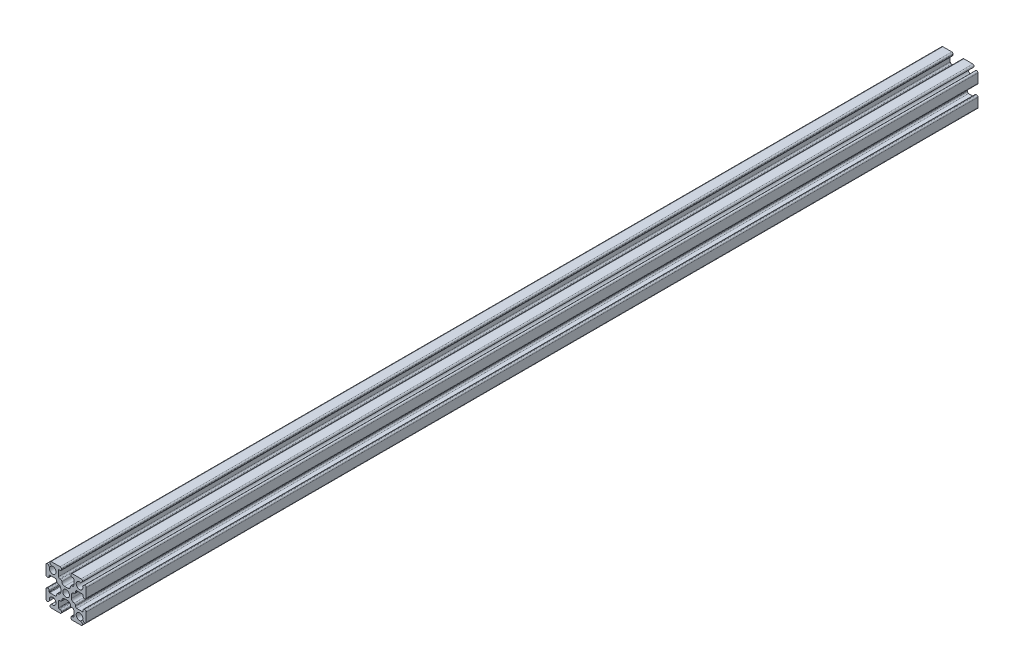
from build123d import *

# Parameters (mm, degrees)
SKETCH1_R           = 1.25
BOSS_EXTRUDE1_DEPTH = 332.35


with BuildPart() as part:
    # Sketch1 → Boss-Extrude1 (new body)
    with BuildSketch(Plane.XY):
        with BuildLine():
            Line((6.646446609, 5.939339828), (6.163645978, 5.456539197))
            ThreePointArc((6.163645978, 5.456539197), (4.116116524, 4.116116524), (5.456539197, 6.163645978))
            Line((5.456539197, 6.163645978), (5.939339828, 6.646446609))
            ThreePointArc((5.939339828, 6.646446609), (6.047726204, 7.191341716), (5.585786438, 7.5))
            Line((5.585786438, 7.5), (2.25, 7.5))
            ThreePointArc((2.25, 7.5), (1.896446609, 7.353553391), (1.75, 7))
            Line((1.75, 7), (1.75, 6.8))
            ThreePointArc((1.75, 6.8), (1.896446609, 6.446446609), (2.25, 6.3))
            Line((2.25, 6.3), (2.65, 6.3))
            ThreePointArc((2.65, 6.3), (2.791421356, 6.241421356), (2.85, 6.1))
            Line((2.85, 6.1), (2.85, 4))
            ThreePointArc((2.85, 4), (2.703553391, 3.646446609), (2.35, 3.5))
            Line((2.35, 3.5), (2.1, 3.5))
            ThreePointArc((2.1, 3.5), (1.746446609, 3.353553391), (1.6, 3))
            ThreePointArc((1.6, 3), (1.307106781, 2.292893219), (0.6, 2))
            Line((0.6, 2), (-0.6, 2))
            ThreePointArc((-0.6, 2), (-1.307106781, 2.292893219), (-1.6, 3))
            ThreePointArc((-1.6, 3), (-1.746446609, 3.353553391), (-2.1, 3.5))
            Line((-2.1, 3.5), (-2.35, 3.5))
            ThreePointArc((-2.35, 3.5), (-2.703553391, 3.646446609), (-2.85, 4))
            Line((-2.85, 4), (-2.85, 6.1))
            ThreePointArc((-2.85, 6.1), (-2.791421356, 6.241421356), (-2.65, 6.3))
            Line((-2.65, 6.3), (-2.25, 6.3))
            ThreePointArc((-2.25, 6.3), (-1.896446609, 6.446446609), (-1.75, 6.8))
            Line((-1.75, 6.8), (-1.75, 7))
            ThreePointArc((-1.75, 7), (-1.896446609, 7.353553391), (-2.25, 7.5))
            Line((-2.25, 7.5), (-5.585786438, 7.5))
            ThreePointArc((-5.585786438, 7.5), (-6.047726204, 7.191341716), (-5.939339828, 6.646446609))
            Line((-5.939339828, 6.646446609), (-5.456539197, 6.163645978))
            ThreePointArc((-5.456539197, 6.163645978), (-4.116116524, 4.116116524), (-6.163645978, 5.456539197))
            Line((-6.163645978, 5.456539197), (-6.646446609, 5.939339828))
            ThreePointArc((-6.646446609, 5.939339828), (-7.191341716, 6.047726204), (-7.5, 5.585786438))
            Line((-7.5, 5.585786438), (-7.5, 2.25))
            ThreePointArc((-7.5, 2.25), (-7.353553391, 1.896446609), (-7, 1.75))
            Line((-7, 1.75), (-6.8, 1.75))
            ThreePointArc((-6.8, 1.75), (-6.446446609, 1.896446609), (-6.3, 2.25))
            Line((-6.3, 2.25), (-6.3, 2.65))
            ThreePointArc((-6.3, 2.65), (-6.241421356, 2.791421356), (-6.1, 2.85))
            Line((-6.1, 2.85), (-4, 2.85))
            ThreePointArc((-4, 2.85), (-3.646446609, 2.703553391), (-3.5, 2.35))
            Line((-3.5, 2.35), (-3.5, 2.1))
            ThreePointArc((-3.5, 2.1), (-3.353553391, 1.746446609), (-3, 1.6))
            ThreePointArc((-3, 1.6), (-2.292893219, 1.307106781), (-2, 0.6))
            Line((-2, 0.6), (-2, -0.6))
            ThreePointArc((-2, -0.6), (-2.292893219, -1.307106781), (-3, -1.6))
            ThreePointArc((-3, -1.6), (-3.353553391, -1.746446609), (-3.5, -2.1))
            Line((-3.5, -2.1), (-3.5, -2.35))
            ThreePointArc((-3.5, -2.35), (-3.646446609, -2.703553391), (-4, -2.85))
            Line((-4, -2.85), (-6.1, -2.85))
            ThreePointArc((-6.1, -2.85), (-6.241421356, -2.791421356), (-6.3, -2.65))
            Line((-6.3, -2.65), (-6.3, -2.25))
            ThreePointArc((-6.3, -2.25), (-6.446446609, -1.896446609), (-6.8, -1.75))
            Line((-6.8, -1.75), (-7, -1.75))
            ThreePointArc((-7, -1.75), (-7.353553391, -1.896446609), (-7.5, -2.25))
            Line((-7.5, -2.25), (-7.5, -5.585786438))
            ThreePointArc((-7.5, -5.585786438), (-7.191341716, -6.047726204), (-6.646446609, -5.939339828))
            Line((-6.646446609, -5.939339828), (-6.163645978, -5.456539197))
            ThreePointArc((-6.163645978, -5.456539197), (-4.116116524, -4.116116524), (-5.456539197, -6.163645978))
            Line((-5.456539197, -6.163645978), (-5.939339828, -6.646446609))
            ThreePointArc((-5.939339828, -6.646446609), (-6.047726204, -7.191341716), (-5.585786438, -7.5))
            Line((-5.585786438, -7.5), (-2.25, -7.5))
            ThreePointArc((-2.25, -7.5), (-1.896446609, -7.353553391), (-1.75, -7))
            Line((-1.75, -7), (-1.75, -6.8))
            ThreePointArc((-1.75, -6.8), (-1.896446609, -6.446446609), (-2.25, -6.3))
            Line((-2.25, -6.3), (-2.65, -6.3))
            ThreePointArc((-2.65, -6.3), (-2.791421356, -6.241421356), (-2.85, -6.1))
            Line((-2.85, -6.1), (-2.85, -4))
            ThreePointArc((-2.85, -4), (-2.703553391, -3.646446609), (-2.35, -3.5))
            Line((-2.35, -3.5), (-2.1, -3.5))
            ThreePointArc((-2.1, -3.5), (-1.746446609, -3.353553391), (-1.6, -3))
            ThreePointArc((-1.6, -3), (-1.307106781, -2.292893219), (-0.6, -2))
            Line((-0.6, -2), (0.6, -2))
            ThreePointArc((0.6, -2), (1.307106781, -2.292893219), (1.6, -3))
            ThreePointArc((1.6, -3), (1.746446609, -3.353553391), (2.1, -3.5))
            Line((2.1, -3.5), (2.35, -3.5))
            ThreePointArc((2.35, -3.5), (2.703553391, -3.646446609), (2.85, -4))
            Line((2.85, -4), (2.85, -6.1))
            ThreePointArc((2.85, -6.1), (2.791421356, -6.241421356), (2.65, -6.3))
            Line((2.65, -6.3), (2.25, -6.3))
            ThreePointArc((2.25, -6.3), (1.896446609, -6.446446609), (1.75, -6.8))
            Line((1.75, -6.8), (1.75, -7))
            ThreePointArc((1.75, -7), (1.896446609, -7.353553391), (2.25, -7.5))
            Line((2.25, -7.5), (5.585786438, -7.5))
            ThreePointArc((5.585786438, -7.5), (6.047726204, -7.191341716), (5.939339828, -6.646446609))
            Line((5.939339828, -6.646446609), (5.456539197, -6.163645978))
            ThreePointArc((5.456539197, -6.163645978), (4.116116524, -4.116116524), (6.163645978, -5.456539197))
            Line((6.163645978, -5.456539197), (6.646446609, -5.939339828))
            ThreePointArc((6.646446609, -5.939339828), (7.191341716, -6.047726204), (7.5, -5.585786438))
            Line((7.5, -5.585786438), (7.5, -2.25))
            ThreePointArc((7.5, -2.25), (7.353553391, -1.896446609), (7, -1.75))
            Line((7, -1.75), (6.8, -1.75))
            ThreePointArc((6.8, -1.75), (6.446446609, -1.896446609), (6.3, -2.25))
            Line((6.3, -2.25), (6.3, -2.65))
            ThreePointArc((6.3, -2.65), (6.241421356, -2.791421356), (6.1, -2.85))
            Line((6.1, -2.85), (4, -2.85))
            ThreePointArc((4, -2.85), (3.646446609, -2.703553391), (3.5, -2.35))
            Line((3.5, -2.35), (3.5, -2.1))
            ThreePointArc((3.5, -2.1), (3.353553391, -1.746446609), (3, -1.6))
            ThreePointArc((3, -1.6), (2.292893219, -1.307106781), (2, -0.6))
            Line((2, -0.6), (2, 0.6))
            ThreePointArc((2, 0.6), (2.292893219, 1.307106781), (3, 1.6))
            ThreePointArc((3, 1.6), (3.353553391, 1.746446609), (3.5, 2.1))
            Line((3.5, 2.1), (3.5, 2.35))
            ThreePointArc((3.5, 2.35), (3.646446609, 2.703553391), (4, 2.85))
            Line((4, 2.85), (6.1, 2.85))
            ThreePointArc((6.1, 2.85), (6.241421356, 2.791421356), (6.3, 2.65))
            Line((6.3, 2.65), (6.3, 2.25))
            ThreePointArc((6.3, 2.25), (6.446446609, 1.896446609), (6.8, 1.75))
            Line((6.8, 1.75), (7, 1.75))
            ThreePointArc((7, 1.75), (7.353553391, 1.896446609), (7.5, 2.25))
            Line((7.5, 2.25), (7.5, 5.585786438))
            ThreePointArc((7.5, 5.585786438), (7.191341716, 6.047726204), (6.646446609, 5.939339828))
        make_face()
        Circle(SKETCH1_R, mode=Mode.SUBTRACT)
    extrude(amount=BOSS_EXTRUDE1_DEPTH)


solid = part.part
